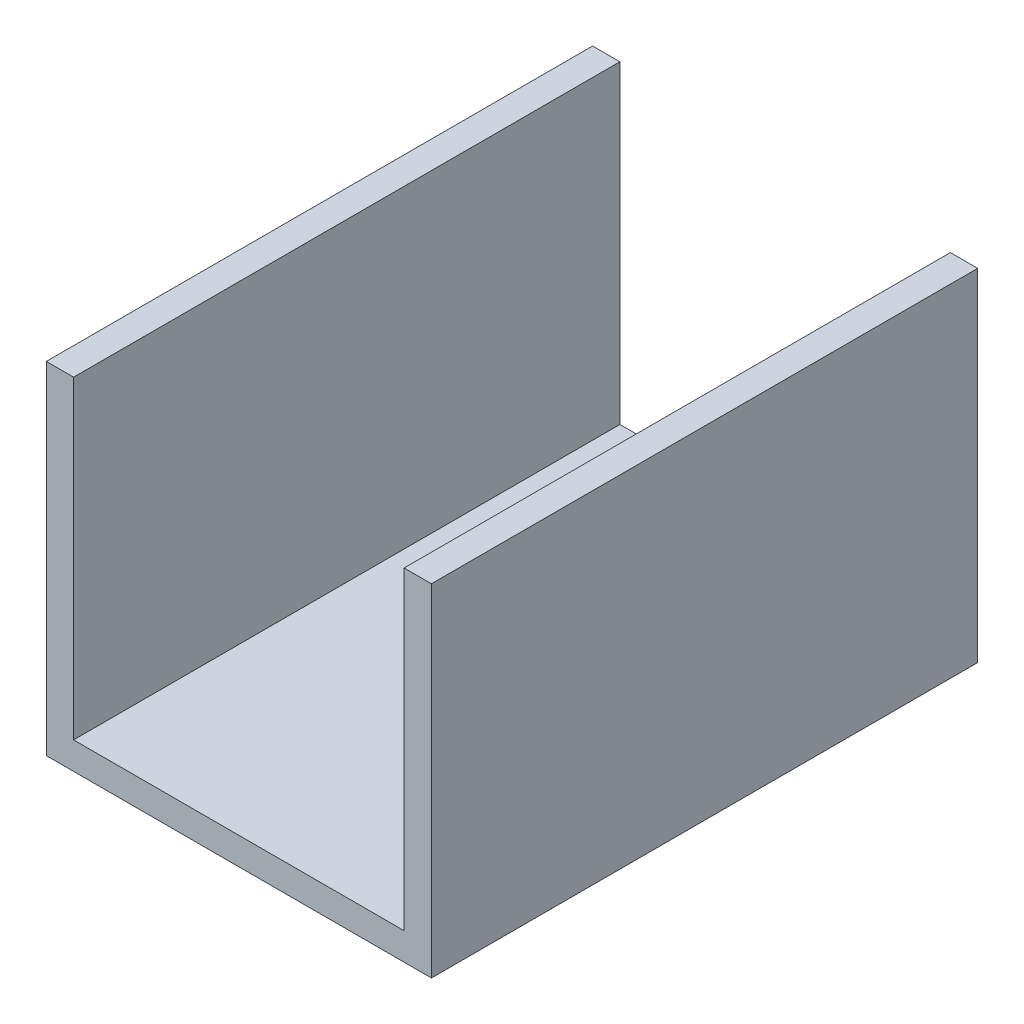
from build123d import *

# Parameters (mm, degrees)
BOSS_EXTRUDE1_DEPTH = 40


with BuildPart() as part:
    # Sketch2 → Boss-Extrude1 (new, symmetric)
    with BuildSketch(Plane.XY):
        Polygon((-24.2, 0), (24.2, 0), (24.2, 46), (28.2, 46), (28.2, -4), (-28.2, -4), (-28.2, 46), (-24.2, 46), align=None)
    extrude(amount=BOSS_EXTRUDE1_DEPTH, both=True)


solid = part.part
